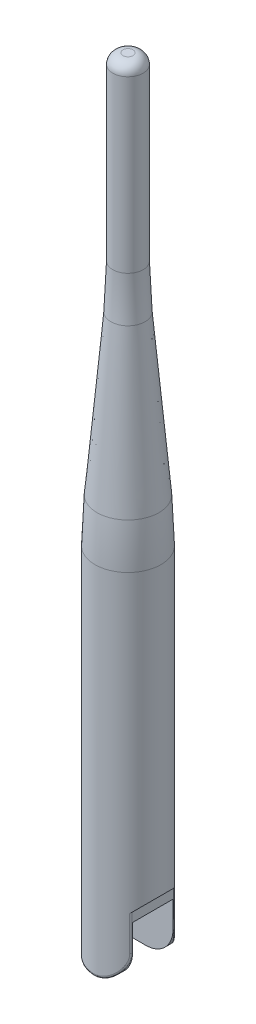
from build123d import *

# Parameters (mm, degrees)
FILLET1_R               = 2
FILLET2_R               = 100
CUT_EXTRUDE1_DEPTH      = 156.272341396
CUT_EXTRUDE1_DEPTH_BACK = 156.272341396
SKETCH3_W               = 11
SKETCH3_H               = 8
CUT_EXTRUDE2_DEPTH      = 10.6
FILLET3_R               = 0.5


with BuildPart() as part:
    # Sketch1 → Revolve1 (revolve)
    with BuildSketch(Plane.XY, mode=Mode.PRIVATE) as revolve1_sk:
        Polygon((6.5, 0), (6.5, 75), (3, 115), (3, 155), (0, 155), (0, 0), align=None)
    revolve(revolve1_sk.sketch.rotate(Axis((0, 0, 0), (0, 1, 0)), 90), axis=Axis((0, 0, 0), (0, 1, 0)))

    # Fillet1
    fillet1_edges = [part.edges().sort_by_distance(p)[0] for p in [
        (0, 155, 3),
    ]]
    fillet(fillet1_edges, radius=FILLET1_R)

    # Fillet2
    # the kernel refuses this fillet: 100 mm, written as the material it adds along each edge
    with BuildSketch(Plane(origin=(0, 115, 0), x_dir=(0, 0, -1), z_dir=(1, 0, 0))) as fillet2_piece_1:
        with BuildLine():
            CenterArc((3 + FILLET2_R, FILLET2_R * 0.0436665788079), FILLET2_R, 180, 5.000644598)
            Line((3 + FILLET2_R * 0.00380628250389, -FILLET2_R * 0.043500371473), (3 - FILLET2_R * 0.016117591846, -FILLET2_R * 0.0452437104786))
            Line((3 - FILLET2_R * 0.016117591846, -FILLET2_R * 0.0452437104786), (3 - FILLET2_R * 0.0199238743499, -FILLET2_R * 0.00174333900562))
            Line((3 - FILLET2_R * 0.0199238743499, -FILLET2_R * 0.00174333900562), (3 - FILLET2_R * 0.02, 0))
            Line((3 - FILLET2_R * 0.02, 0), (3 - FILLET2_R * 0.02, FILLET2_R * 0.0436665788079))
            Line((3 - FILLET2_R * 0.02, FILLET2_R * 0.0436665788079), (3, FILLET2_R * 0.0436665788079))
        make_face()
    revolve(axis=Axis((0, 115, 0), (0, 1, 0)))
    # the kernel refuses this fillet: 100 mm, written as the material it takes off along each edge
    with BuildSketch(Plane(origin=(0, 75, 0), x_dir=(0, 0, -1), z_dir=(1, 0, 0))) as fillet2_2_piece_1:
        with BuildLine():
            CenterArc((6.5 - FILLET2_R, -FILLET2_R * 0.0436665788079), FILLET2_R, 0, 5.000644598)
            Line((6.5, -FILLET2_R * 0.0436665788079), (6.5 + FILLET2_R * 0.02, -FILLET2_R * 0.0436665788079))
            Line((6.5 + FILLET2_R * 0.02, -FILLET2_R * 0.0436665788079), (6.5 + FILLET2_R * 0.02, FILLET2_R * 0.000873331576158))
            Line((6.5 + FILLET2_R * 0.02, FILLET2_R * 0.000873331576158), (6.5 + FILLET2_R * 0.016117591846, FILLET2_R * 0.0452437104786))
            Line((6.5 + FILLET2_R * 0.016117591846, FILLET2_R * 0.0452437104786), (6.5 - FILLET2_R * 0.00380628250389, FILLET2_R * 0.043500371473))
        make_face()
    revolve(axis=Axis((0, 75, 0), (0, 1, 0)), mode=Mode.SUBTRACT)

    # Sketch2 → Cut-Extrude1 (cut, two sides: drawn at the far end of the back side and taken through both)
    with BuildSketch(Plane.XY.offset(-CUT_EXTRUDE1_DEPTH_BACK)):
        with BuildLine():
            Line((6.5, 14), (4.9, 12.4))
            Line((4.9, 12.4), (4.9, 5.4))
            ThreePointArc((4.9, 5.4), (3.318376618, 1.581623382), (-0.5, 0))
            Line((-0.5, 0), (6.5, 0))
            Line((6.5, 0), (6.5, 14))
        make_face()
    extrude(amount=CUT_EXTRUDE1_DEPTH + CUT_EXTRUDE1_DEPTH_BACK, mode=Mode.SUBTRACT)

    # Sketch3 → Cut-Extrude2 (cut)
    with BuildSketch(Plane(origin=(0, 0, 0), x_dir=(1, 0, 0), z_dir=(0, 1, 0))):
        with Locations((1.4, 0)):
            Rectangle(SKETCH3_W, SKETCH3_H)
    extrude(amount=CUT_EXTRUDE2_DEPTH, mode=Mode.SUBTRACT)

    # Fillet3
    fillet3_edges = [part.edges().sort_by_distance(p)[0] for p in [
        (-6.5, 0, 0),
        (3.349776633, 1.613283763, 5.570367722),
        (3.507900773, 1.781059372, -5.47216888),
        (4.9, 8.9, -4.270831301),
        (4.9, 8.9, 4.270831301),
    ]]
    fillet(fillet3_edges, radius=FILLET3_R)


solid = part.part
